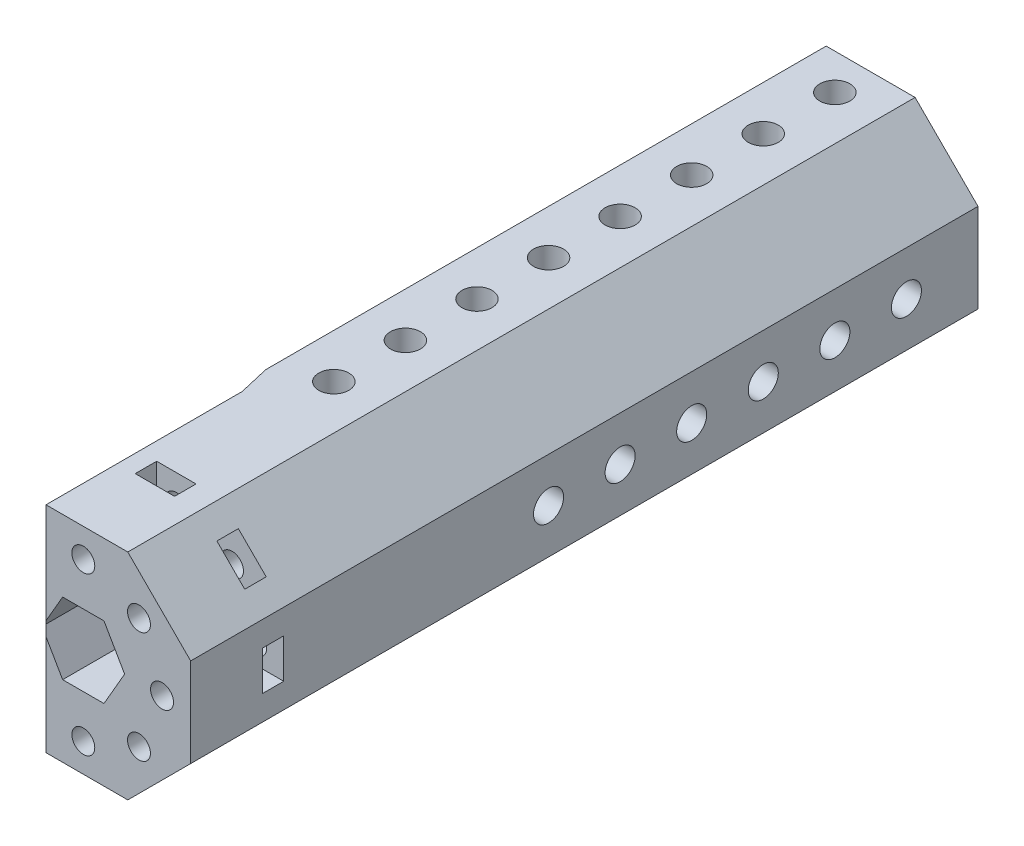
from build123d import *

# Parameters (mm, degrees)
SALIENTE_EXTRUIR1_DEPTH = 55
CORTAR_EXTRUIR3_DEPTH   = 113.026782512
CORTAR_EXTRUIR4_DEPTH   = 116
CROQUIS6_R              = 1.6
CORTAR_EXTRUIR5_DEPTH   = 20
CORTAR_EXTRUIR6_START   = -10
CORTAR_EXTRUIR6_DEPTH   = 3
CROQUIS8_R              = 2.1
CORTAR_EXTRUIR8_DEPTH   = 116
MATRIZL1_COUNT          = 8
MATRIZL1_PITCH          = 10
CHAFL_N1_SIZE           = 1
CROQUIS9_R              = 2.1
CORTAR_EXTRUIR11_DEPTH  = 130.421791055
MATRIZL2_COUNT          = 6
MATRIZL2_PITCH          = 10


with BuildPart() as part:
    # Croquis1 → Saliente-Extruir1 (new body)
    with BuildSketch(Plane.XY):
        Polygon((15, -6.213203436), (15, 6.213203436), (6.213203436, 15), (-6.213203436, 15), (-15, 6.213203436), (-15, -6.213203436), (-6.213203436, -15), (6.213203436, -15), align=None)
    saliente_extruir1 = extrude(amount=SALIENTE_EXTRUIR1_DEPTH)

    # Simetría1: Saliente-Extruir1 across plane
    add(saliente_extruir1.mirror(Plane.XY.offset(55)))

    # Croquis4 → Cortar-Extruir3 (cut, through all)
    with BuildSketch(Plane(origin=(0, 0, 0), x_dir=(-1, 0, 0), z_dir=(0, 0, -1))):
        Polygon((-5.773502692, 0), (-2.886751346, -5), (2.886751346, -5), (5.773502692, 0), (2.886751346, 5), (-2.886751346, 5), align=None)
    extrude(amount=-CORTAR_EXTRUIR3_DEPTH, mode=Mode.SUBTRACT)

    # Croquis5 → Cortar-Extruir4 (cut, through all)
    with BuildSketch(Plane.XZ.offset(15)):
        Polygon((-6.213203436, 110), (-6.213203436, 78.298736304), (-15, 40.569524353), (-15, 110), align=None)
    extrude(amount=-CORTAR_EXTRUIR4_DEPTH, mode=Mode.SUBTRACT)

    # Croquis6 → Cortar-Extruir5 (cut)
    with BuildSketch(Plane.XY.offset(110)):
        with Locations((0, 11)):
            Circle(CROQUIS6_R)
        with Locations((7.778174593, 7.778174593)):
            Circle(CROQUIS6_R)
        with Locations((11, 0)):
            Circle(CROQUIS6_R)
        with Locations((7.778174593, -7.778174593)):
            Circle(CROQUIS6_R)
        with Locations((0, -11)):
            Circle(CROQUIS6_R)
    extrude(amount=-CORTAR_EXTRUIR5_DEPTH, mode=Mode.SUBTRACT)

    # Croquis7 → Cortar-Extruir6 (cut)
    with BuildSketch(Plane.XY.offset(110).offset(CORTAR_EXTRUIR6_START)):
        Polygon((-2.75, 12.58771324), (-2.75, 18.463203436), (2.75, 23.963203436), (2.75, 12.58771324), (2.75, 9.41228676), (0, 7.824573519), (-2.75, 9.41228676), align=None)
        Polygon((6.956313744, 10.84540104), (11.110912703, 15), (18.889087297, 15), (10.84540104, 6.956313744), (8.600035443, 4.710948146), (5.532808996, 5.532808996), (4.710948146, 8.600035443), align=None)
        Polygon((12.58771324, 2.75), (18.463203436, 2.75), (23.963203436, -2.75), (12.58771324, -2.75), (9.41228676, -2.75), (7.824573519, 0), (9.41228676, 2.75), align=None)
        Polygon((10.84540104, -6.956313744), (15, -11.110912703), (15, -18.889087297), (6.956313744, -10.84540104), (4.710948146, -8.600035443), (5.532808996, -5.532808996), (8.600035443, -4.710948146), align=None)
        Polygon((2.75, -12.58771324), (2.75, -18.463203436), (-2.75, -23.963203436), (-2.75, -12.58771324), (-2.75, -9.41228676), (0, -7.824573519), (2.75, -9.41228676), align=None)
    extrude(amount=-CORTAR_EXTRUIR6_DEPTH, mode=Mode.SUBTRACT)

    # Croquis8 → Cortar-Extruir8 (cut, through all)
    with BuildSketch(Plane.XZ.offset(15)):
        with Locations((0, 5)):
            Circle(CROQUIS8_R)
    cortar_extruir8 = extrude(amount=-CORTAR_EXTRUIR8_DEPTH, mode=Mode.SUBTRACT)

    # MatrizL1: Cortar-Extruir8 ×8
    with Locations(*[(0, 0, i * MATRIZL1_PITCH) for i in range(1, MATRIZL1_COUNT)]):
        add(cortar_extruir8, mode=Mode.SUBTRACT)

    # Chaflán1
    # the kernel refuses this chamfer: 1 mm, written as the material it takes off along each edge
    with BuildSketch(Plane(origin=(-6.213203436, -15, 112.571682988), x_dir=(0.9996219169112968, -0.027495876610585623, 0), z_dir=(0, 0, -1))) as chafl_n1_piece_1_section:
        Polygon((CHAFL_N1_SIZE * 0.999621916911, -CHAFL_N1_SIZE * 0.0274958766106), (-CHAFL_N1_SIZE * 0.0274958766106, -CHAFL_N1_SIZE * 0.999621916911), (0, 0), align=None)
    chafl_n1_piece_1 = extrude(amount=34.272946684, mode=Mode.PRIVATE)
    chafl_n1_piece_1 = split(chafl_n1_piece_1, bisect_by=Plane(origin=(-2.540552648, -14.662726337, 94.068558556), z_dir=(-0.9739364396780411, 0, 0.22682110013678505)), keep=Keep.TOP, mode=Mode.PRIVATE)
    add(chafl_n1_piece_1, mode=Mode.SUBTRACT)
    with BuildSketch(Plane(origin=(-6.213203436, 15, 78.298736304), x_dir=(-0.027495876610583055, -0.9996219169112968, 0), z_dir=(0, 0, 1))) as chafl_n1_piece_2_section:
        Polygon((CHAFL_N1_SIZE * 0.999621916911, CHAFL_N1_SIZE * 0.0274958766106), (-CHAFL_N1_SIZE * 0.0274958766106, CHAFL_N1_SIZE * 0.999621916911), (0, 0), align=None)
    chafl_n1_piece_2 = extrude(amount=34.272946684, mode=Mode.PRIVATE)
    chafl_n1_piece_2 = split(chafl_n1_piece_2, bisect_by=Plane(origin=(-2.540552648, 14.662726337, 94.068558556), z_dir=(-0.9739364396780411, 0, 0.22682110013678505)), keep=Keep.TOP, mode=Mode.PRIVATE)
    add(chafl_n1_piece_2, mode=Mode.SUBTRACT)
    with BuildSketch(Plane(origin=(-6.213203436, -17.571682988, 110), x_dir=(0.999621916911297, 0, 0.027495876610582174), z_dir=(0, 1, 0))) as chafl_n1_piece_3:
        Polygon((CHAFL_N1_SIZE * 0.999621916911, CHAFL_N1_SIZE * 0.0274958766106), (-CHAFL_N1_SIZE * 0.0274958766106, CHAFL_N1_SIZE * 0.999621916911), (0, 0), align=None)
    extrude(amount=35.143365976, mode=Mode.SUBTRACT)

    # Croquis9 → Cortar-Extruir11 (cut, through all)
    with BuildSketch(Plane(origin=(15, 0, -15), x_dir=(0, 0, -1), z_dir=(-1, 0, 0))):
        with Locations((-25, 0)):
            Circle(CROQUIS9_R)
    cortar_extruir11 = extrude(amount=CORTAR_EXTRUIR11_DEPTH, mode=Mode.SUBTRACT)

    # MatrizL2: Cortar-Extruir11 ×6
    with Locations(*[(0, 0, i * MATRIZL2_PITCH) for i in range(1, MATRIZL2_COUNT)]):
        add(cortar_extruir11, mode=Mode.SUBTRACT)


solid = part.part
